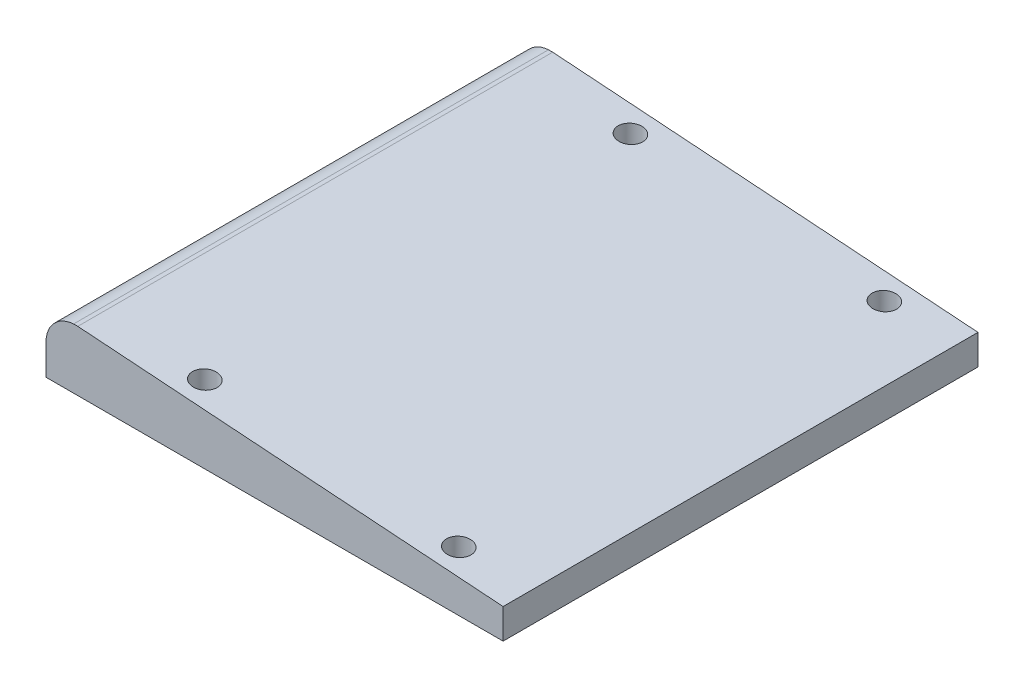
from build123d import *

# Parameters (mm, degrees)
SKETCH1_W                               = 228.6
SKETCH1_H                               = 237.5
BOSS_EXTRUDE1_DEPTH                     = 30
CUT_EXTRUDE1_DEPTH                      = 168.529258639
CUT_EXTRUDE1_DEPTH_BACK                 = 168.529258639
CBORE_FOR_M5_HEX_HEAD_BOLT1_D           = 5.5
CBORE_FOR_M5_HEX_HEAD_BOLT1_CBORE_D     = 12.24
CBORE_FOR_M5_HEX_HEAD_BOLT1_CBORE_DEPTH = 23.58


with BuildPart() as part:
    # Sketch1 → Boss-Extrude1 (new body)
    with BuildSketch(Plane(origin=(0, 0, 0), x_dir=(1, 0, 0), z_dir=(0, 1, 0))):
        Rectangle(SKETCH1_W, SKETCH1_H)
    extrude(amount=BOSS_EXTRUDE1_DEPTH)

    # Sketch2 → Cut-Extrude1 (cut, two sides: drawn at the far end of the back side and taken through both)
    with BuildSketch(Plane.XY.offset(-CUT_EXTRUDE1_DEPTH_BACK)):
        with BuildLine():
            ThreePointArc((-114.3, 15), (-110.370075125, 25.243389174), (-100.483418221, 30))
            Line((-100.483418221, 30), (-114.3, 30))
            ThreePointArc((-114.3, 30), (-114.343802454, 22.5), (-114.3, 15))
        make_face()
        Polygon((-98.392171464, 30), (114.3, 15), (114.3, 30), align=None)
    extrude(amount=CUT_EXTRUDE1_DEPTH + CUT_EXTRUDE1_DEPTH_BACK, mode=Mode.SUBTRACT)

    # CBORE for M5 Hex Head Bolt1 (through all)
    with Locations(Plane(origin=(0, 30.036825278, 0), x_dir=(1, 0, 0), z_dir=(0, 1, 0))):
        with Locations((-47.2, 106.42), (79.8, 106.42), (79.8, -106.42), (-47.2, -106.42)):
            CounterBoreHole(CBORE_FOR_M5_HEX_HEAD_BOLT1_D / 2, CBORE_FOR_M5_HEX_HEAD_BOLT1_CBORE_D / 2, CBORE_FOR_M5_HEX_HEAD_BOLT1_CBORE_DEPTH)


solid = part.part
